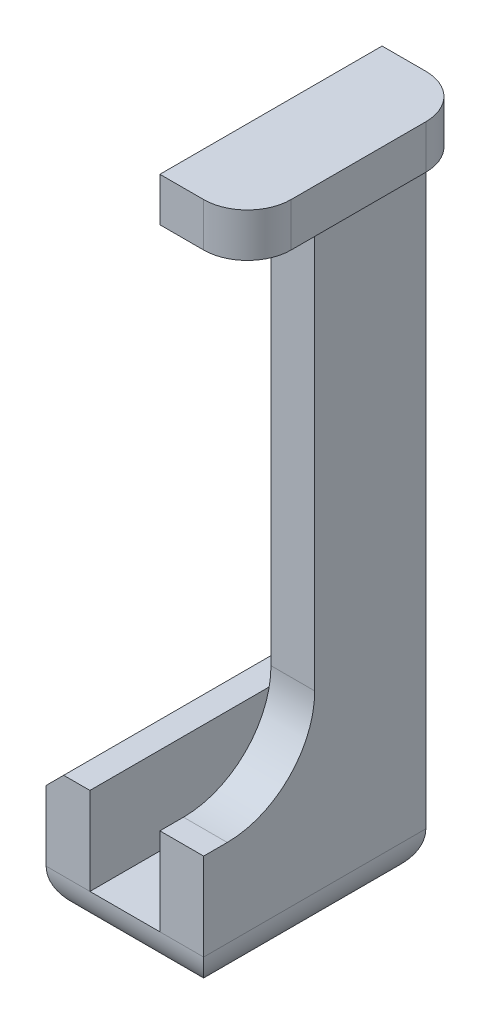
from build123d import *

# Parameters (mm, degrees)
BOSS_EXTRUDE1_DEPTH = 12.7
BOSS_EXTRUDE2_DEPTH = 12.7
FILLET1_R           = 10
FILLET2_R           = 5
CHAMFER2_SIZE       = 2


with BuildPart() as part:
    # Sketch1 → Boss-Extrude1 (new body)
    with BuildSketch(Plane.XY):
        Polygon((0, 0), (-8, 0), (-8, 10), (-13, 10), (-13, -5), (5, -5), (5, 70), (10, 70), (10, 75), (0, 75), align=None)
    extrude(amount=BOSS_EXTRUDE1_DEPTH)

    # Sketch2 → Boss-Extrude2 (add)
    with BuildSketch(Plane.XY.offset(12.7)):
        Polygon((5, 10), (0, 10), (0, 0), (-8, 0), (-8, 10), (-13, 10), (-13, -5), (5, -5), align=None)
        Polygon((0, 75), (0, 70), (5, 70), (10, 70), (10, 75), align=None)
    extrude(amount=BOSS_EXTRUDE2_DEPTH)

    # Fillet1
    fillet1_edges = [part.edges().sort_by_distance(p)[0] for p in [
        (2.5, 10, 12.7),
    ]]
    fillet(fillet1_edges, radius=FILLET1_R)

    # Fillet2
    fillet2_edges = [part.edges().sort_by_distance(p)[0] for p in [
        (-13, -5, 12.7),
        (-4, -5, 25.4),
        (5, -5, 12.7),
        (-4, -5, 0),
        (10, 72.5, 0),
        (10, 72.5, 25.4),
        (2.5, 70, 12.7),
    ]]
    fillet(fillet2_edges, radius=FILLET2_R - 0.0001)  # a hair under: the kernel refuses the full size

    # Chamfer2
    chamfer2_edges = [part.edges().sort_by_distance(p)[0] for p in [
        (-13, 10, 12.7),
    ]]
    chamfer(chamfer2_edges, length=CHAMFER2_SIZE)


solid = part.part
